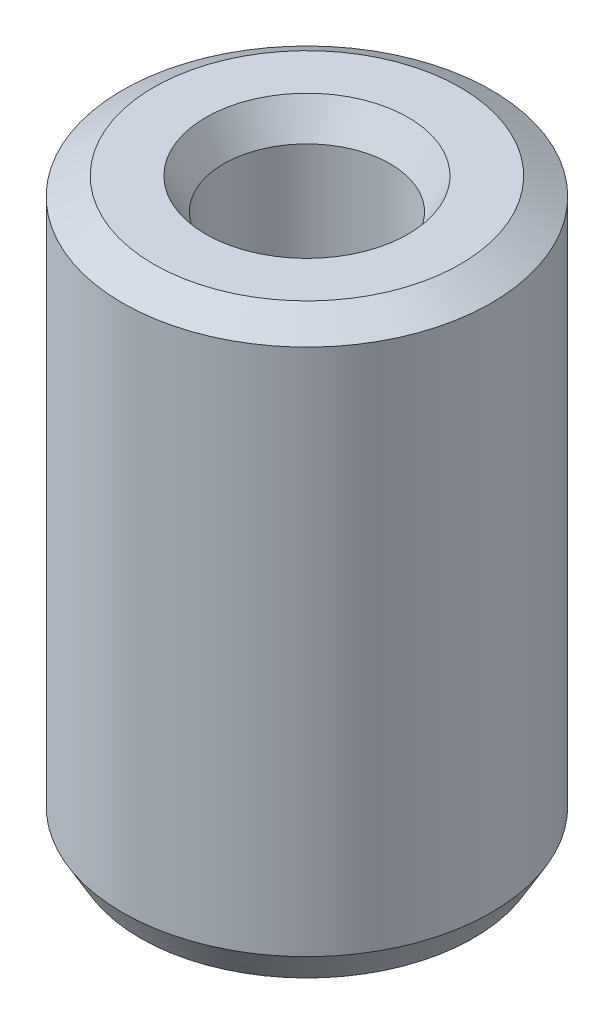
from build123d import *
from OCP.BRepFilletAPI import BRepFilletAPI_MakeChamfer

# Parameters (mm, degrees)
SKETCH1_R           = 20
BOSS_EXTRUDE1_DEPTH = 62.579251085
SKETCH2_R           = 9.022986287
CUT_EXTRUDE1_DEPTH  = 69.674323196
CHAMFER1_SIZE       = 1.951054023
CHAMFER1_SIZE2      = 3.379324696


with BuildPart() as part:
    # Sketch1 → Boss-Extrude1 (new body)
    with BuildSketch(Plane(origin=(0, 0, 0), x_dir=(1, 0, 0), z_dir=(0, 1, 0))):
        Circle(SKETCH1_R)
    extrude(amount=BOSS_EXTRUDE1_DEPTH)

    # Sketch2 → Cut-Extrude1 (cut, through all)
    with BuildSketch(Plane(origin=(0, 0, 0), x_dir=(1, 0, 0), z_dir=(0, 1, 0))):
        Circle(SKETCH2_R)
    extrude(amount=CUT_EXTRUDE1_DEPTH, mode=Mode.SUBTRACT)

    # Chamfer1: one chamfer whose edges measure the first distance from different faces: ONE call of the kernel's chamfer builder (chamfer() names one face for all edges)
    chamfer1_edges_1 = [part.edges().sort_by_distance(p)[0] for p in [
        (-9.022986287, 62.579251085, 0),
    ]]
    chamfer1_side_1 = [part.faces().sort_by_distance(p)[0] for p in [
        (-19.434314575, 62.579251085, 0),
    ]]
    chamfer1_edges_2 = [part.edges().sort_by_distance(p)[0] for p in [
        (-9.022986287, 0, 0),
    ]]
    chamfer1_side_2 = [part.faces().sort_by_distance(p)[0] for p in [
        (-9.022986287, 31.289625543, 0),
    ]]
    chamfer1_edges_3 = [part.edges().sort_by_distance(p)[0] for p in [
        (-20, 0, 0),
    ]]
    chamfer1_side_3 = [part.faces().sort_by_distance(p)[0] for p in [
        (-19.434314575, 0, 0),
    ]]
    chamfer1_edges_4 = [part.edges().sort_by_distance(p)[0] for p in [
        (-20, 62.579251085, 0),
    ]]
    chamfer1_side_4 = [part.faces().sort_by_distance(p)[0] for p in [
        (-20, 31.289625543, 0),
    ]]
    chamfer1 = BRepFilletAPI_MakeChamfer(part.part.solid().wrapped)
    for e in chamfer1_edges_1:
        chamfer1.Add(CHAMFER1_SIZE, CHAMFER1_SIZE2, e.wrapped, chamfer1_side_1[0].wrapped)  # the first distance lies on this face
    for e in chamfer1_edges_2:
        chamfer1.Add(CHAMFER1_SIZE, CHAMFER1_SIZE2, e.wrapped, chamfer1_side_2[0].wrapped)  # the first distance lies on this face
    for e in chamfer1_edges_3:
        chamfer1.Add(CHAMFER1_SIZE, CHAMFER1_SIZE2, e.wrapped, chamfer1_side_3[0].wrapped)  # the first distance lies on this face
    for e in chamfer1_edges_4:
        chamfer1.Add(CHAMFER1_SIZE, CHAMFER1_SIZE2, e.wrapped, chamfer1_side_4[0].wrapped)  # the first distance lies on this face
    add(Compound.cast(chamfer1.Shape()), mode=Mode.REPLACE)


solid = part.part
